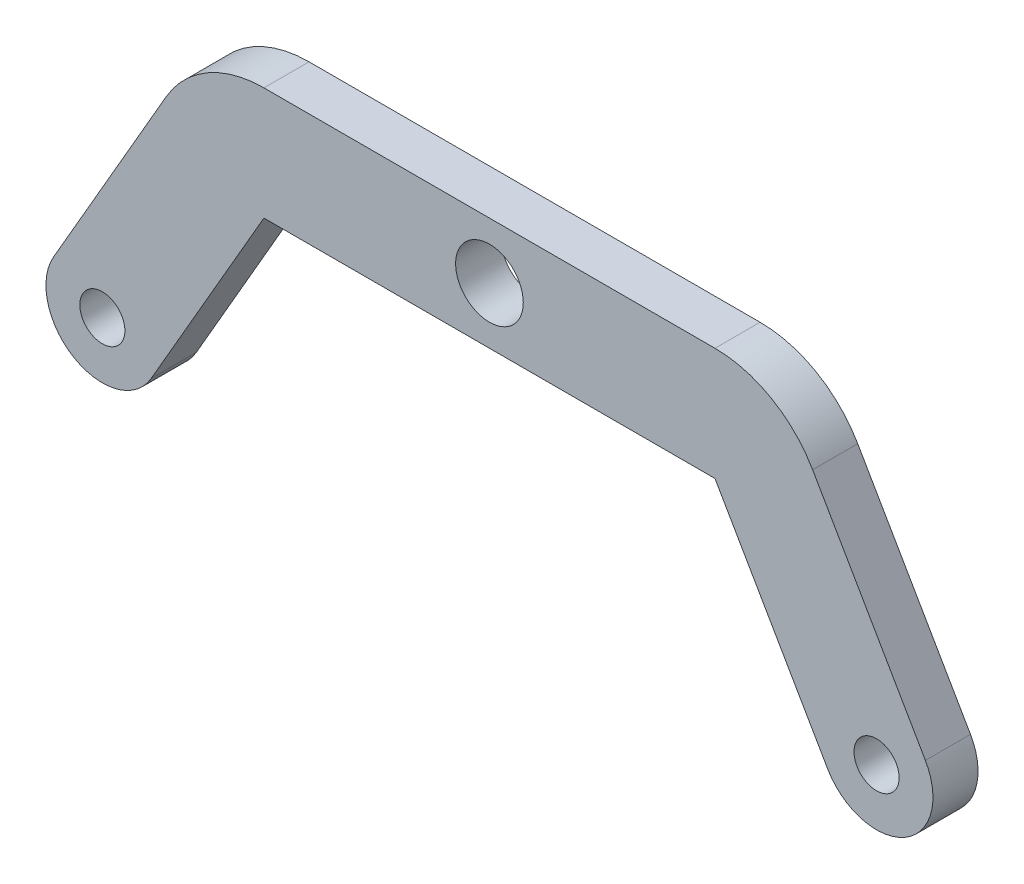
from build123d import *

# Parameters (mm, degrees)
SKETCH1_R           = 7.5
SKETCH1_R_2         = 5
BOSS_EXTRUDE1_DEPTH = 5


with BuildPart() as part:
    # Sketch1 → Boss-Extrude1 (new, symmetric)
    with BuildSketch(Plane.XY):
        with BuildLine():
            Line((-50, 12.5), (50, 12.5))
            ThreePointArc((50, 12.5), (62.5, 9.150635095), (71.650635095, 0))
            Line((71.650635095, 0), (96.650635095, -43.301270189))
            ThreePointArc((96.650635095, -43.301270189), (92.075317547, -60.376587737), (75, -55.801270189))
            Line((75, -55.801270189), (50, -12.5))
            Line((50, -12.5), (-50, -12.5))
            Line((-50, -12.5), (-75, -55.801270189))
            ThreePointArc((-75, -55.801270189), (-92.075317547, -60.376587737), (-96.650635095, -43.301270189))
            Line((-96.650635095, -43.301270189), (-71.650635095, 0))
            ThreePointArc((-71.650635095, 0), (-62.5, 9.150635095), (-50, 12.5))
        make_face()
        Circle(SKETCH1_R, mode=Mode.SUBTRACT)
        with Locations((-85.825317547, -49.551270189)):
            Circle(SKETCH1_R_2, mode=Mode.SUBTRACT)
        with Locations((85.825317547, -49.551270189)):
            Circle(SKETCH1_R_2, mode=Mode.SUBTRACT)
    extrude(amount=BOSS_EXTRUDE1_DEPTH, both=True)


solid = part.part
